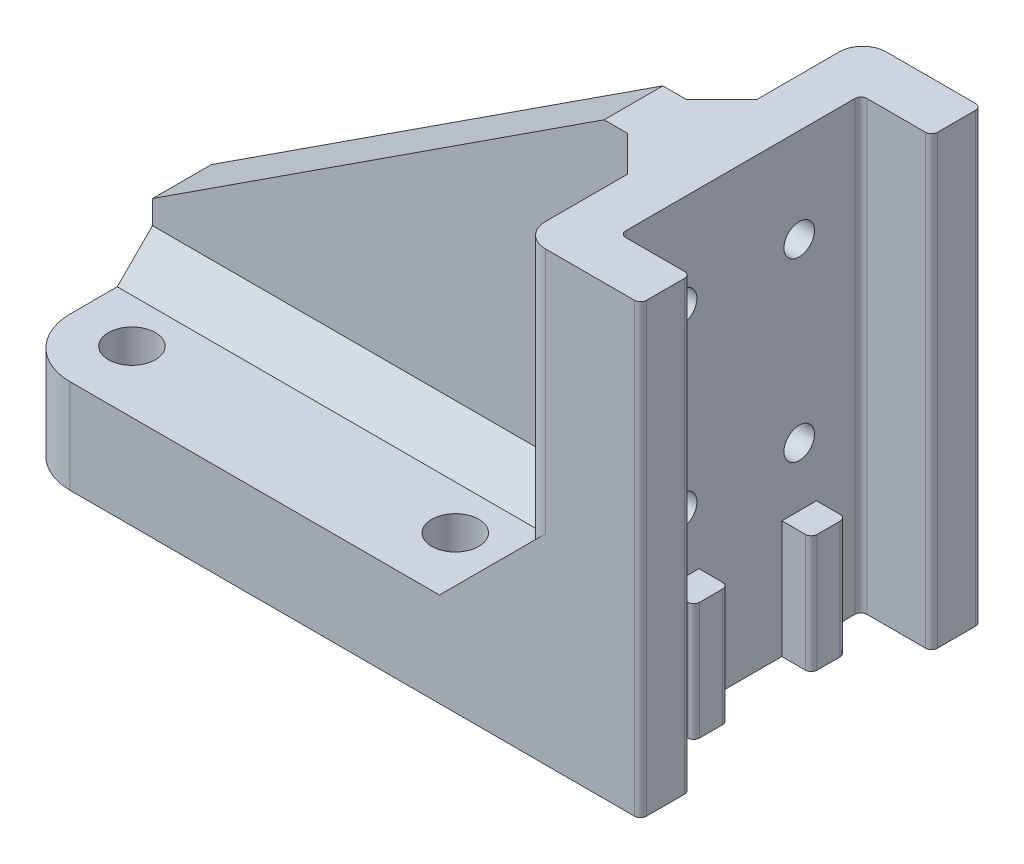
from build123d import *

# Parameters (mm, degrees)
ESQUISSE1_W             = 75
ESQUISSE1_H             = 58
ESQUISSE1_R             = 4
BOSS_EXTRU_1_DEPTH      = 16
ESQUISSE2_W             = 58
ESQUISSE2_H             = 16
BOSS_EXTRU_2_DEPTH      = 20
ESQUISSE3_W             = 8.190465892
ESQUISSE3_H             = 58
BOSS_EXTRU_3_DEPTH      = 60
ESQUISSE4_W             = 8.5
ESQUISSE4_H             = 76
BOSS_EXTRU_4_DEPTH      = 12
ESQUISSE5_W             = 5.9
ESQUISSE5_H             = 20
BOSS_EXTRU_5_DEPTH      = 5
ESQUISSE6_W             = 10
ESQUISSE6_H             = 60
BOSS_EXTRU_6_DEPTH      = 86.809534108
ESQUISSE7_R             = 2.6
ENL_V_MAT_EXTRU_1_DEPTH = 119.965941395
ESQUISSE8_R             = 4.5
ENL_V_MAT_EXTRU_2_DEPTH = 3
ENL_V_MAT_EXTRU_3_DEPTH = 109.45390726
CHANFREIN1_SIZE         = 14
CHANFREIN2_SIZE         = 6
CHANFREIN3_SIZE         = 6
CONG_1_R                = 10
CONG_2_R                = 4
CONG_3_R                = 1
CONG_4_R                = 1


with BuildPart() as part:
    # Esquisse1 → Boss.-Extru.1 (new body)
    with BuildSketch(Plane(origin=(0, 0, 0), x_dir=(1, 0, 0), z_dir=(0, 1, 0))):
        Rectangle(ESQUISSE1_W, ESQUISSE1_H)
        with Locations(Location((-27.5, 18.5, 0), (0, 0, 270))):
            Circle(ESQUISSE1_R, mode=Mode.SUBTRACT)
        with Locations(Location((27.5, 18.5, 0), (0, 0, 90))):
            Circle(ESQUISSE1_R, mode=Mode.SUBTRACT)
        with Locations(Location((27.5, -18.5, 0), (0, 0, 270))):
            Circle(ESQUISSE1_R, mode=Mode.SUBTRACT)
        with Locations(Location((-27.5, -18.5, 0), (0, 0, 90))):
            Circle(ESQUISSE1_R, mode=Mode.SUBTRACT)
    extrude(amount=BOSS_EXTRU_1_DEPTH)

    # Esquisse2 → Boss.-Extru.2 (add)
    with BuildSketch(Plane(origin=(37.5, 0, 0), x_dir=(0, 0, -1), z_dir=(1, 0, 0))):
        with Locations((0, 8)):
            Rectangle(ESQUISSE2_W, ESQUISSE2_H)
    extrude(amount=BOSS_EXTRU_2_DEPTH)

    # Esquisse3 → Boss.-Extru.3 (add)
    with BuildSketch(Plane(origin=(0, 16, 0), x_dir=(1, 0, 0), z_dir=(0, 1, 0))):
        with Locations((53.404767054, 0)):
            Rectangle(ESQUISSE3_W, ESQUISSE3_H)
    extrude(amount=BOSS_EXTRU_3_DEPTH)

    # Esquisse4 → Boss.-Extru.4 (add)
    with BuildSketch(Plane(origin=(57.5, 0, 0), x_dir=(0, 0, -1), z_dir=(1, 0, 0))):
        with Locations((24.75, 38)):
            Rectangle(ESQUISSE4_W, ESQUISSE4_H)
        with Locations((-24.75, 38)):
            Rectangle(ESQUISSE4_W, ESQUISSE4_H)
    extrude(amount=BOSS_EXTRU_4_DEPTH)

    # Esquisse5 → Boss.-Extru.5 (add)
    with BuildSketch(Plane(origin=(57.5, 0, 0), x_dir=(0, 0, -1), z_dir=(1, 0, 0))):
        with Locations((-10, 10)):
            Rectangle(ESQUISSE5_W, ESQUISSE5_H)
        with Locations((10, 10)):
            Rectangle(ESQUISSE5_W, ESQUISSE5_H)
    extrude(amount=BOSS_EXTRU_5_DEPTH)

    # Esquisse6 → Boss.-Extru.6 (add)
    with BuildSketch(Plane.ZY.offset(-49.309534108)):
        with Locations((0, 46)):
            Rectangle(ESQUISSE6_W, ESQUISSE6_H)
    extrude(amount=BOSS_EXTRU_6_DEPTH)

    # Esquisse7 → Enlèv. mat.-Extru.1 (cut, through all)
    with BuildSketch(Plane.ZY.offset(-49.309534108)):
        with Locations((-10, 60)):
            Circle(ESQUISSE7_R)
        with Locations((-10, 30)):
            Circle(ESQUISSE7_R)
        with Locations(Location((10, 30, 0), (0, 0, 180))):
            Circle(ESQUISSE7_R)
        with Locations(Location((10, 60, 0), (0, 0, 180))):
            Circle(ESQUISSE7_R)
    extrude(amount=-ENL_V_MAT_EXTRU_1_DEPTH, mode=Mode.SUBTRACT)

    # Esquisse8 → Enlèv. mat.-Extru.2 (cut)
    with BuildSketch(Plane.ZY.offset(-49.309534108)):
        with Locations((-10, 60)):
            Circle(ESQUISSE8_R)
        with Locations((-10, 30)):
            Circle(ESQUISSE8_R)
        with Locations((10, 60)):
            Circle(ESQUISSE8_R)
        with Locations((10, 30)):
            Circle(ESQUISSE8_R)
    extrude(amount=-ENL_V_MAT_EXTRU_2_DEPTH, mode=Mode.SUBTRACT)

    # Esquisse9 → Enlèv. mat.-Extru.3 (cut, through all)
    with BuildSketch(Plane(origin=(0, 0, -5), x_dir=(-1, 0, 0), z_dir=(0, 0, -1))):
        Polygon((-39.309534108, 76), (37.5, 26), (37.5, 76), align=None)
    extrude(amount=-ENL_V_MAT_EXTRU_3_DEPTH, mode=Mode.SUBTRACT)

    # Chanfrein1
    # the kernel refuses this chamfer: 14 mm, written as the material it adds along each edge
    with BuildSketch(Plane(origin=(49.309534108, 16, -31.003561832), x_dir=(-0.9996219169112968, -0.027495876610586358, 0), z_dir=(0, 0, 1))) as chanfrein1_piece_1_section:
        Polygon((CHANFREIN1_SIZE * 0.999621916911, -CHANFREIN1_SIZE * 0.0274958766106), (-CHANFREIN1_SIZE * 0.0274958766106, -CHANFREIN1_SIZE * 0.999621916911), (0, 0), align=None)
    chanfrein1_piece_1 = extrude(amount=60.003561832, mode=Mode.PRIVATE)
    chanfrein1_piece_1 = split(chanfrein1_piece_1, bisect_by=Plane(origin=(44.612270729, 20.464073152, -29), z_dir=(0, 0, 1)), keep=Keep.TOP, mode=Mode.PRIVATE)
    chanfrein1_piece_1 = chanfrein1_piece_1 - Plane(origin=(44.612270729, 30, -10), x_dir=(0, 0, 1), z_dir=(-1, 0, 0)) * Cylinder(4.5, 176, mode=Mode.PRIVATE)
    chanfrein1_piece_1 = chanfrein1_piece_1 - Plane(origin=(44.612270729, 30, 10), x_dir=(0, 0, 1), z_dir=(-1, 0, 0)) * Cylinder(4.5, 176, mode=Mode.PRIVATE)
    add(chanfrein1_piece_1)
    with BuildSketch(Plane(origin=(49.309534108, 16, -29), x_dir=(0.02749587661058661, 0.9996219169112968, 0), z_dir=(0, 0, 1))) as chanfrein1_piece_2_section:
        Polygon((CHANFREIN1_SIZE * 0.999621916911, CHANFREIN1_SIZE * 0.0274958766106), (-CHANFREIN1_SIZE * 0.0274958766106, CHANFREIN1_SIZE * 0.999621916911), (0, 0), align=None)
    chanfrein1_piece_2 = extrude(amount=60.003561832, mode=Mode.PRIVATE)
    chanfrein1_piece_2 = chanfrein1_piece_2 - Plane(origin=(44.577827309, 30, -10), x_dir=(0, 0, 1), z_dir=(-1, 0, 0)) * Cylinder(4.5, 176, mode=Mode.PRIVATE)
    chanfrein1_piece_2 = split(chanfrein1_piece_2, bisect_by=Plane(origin=(44.577827309, 20.39830905, 29), z_dir=(0, 0, -1)), keep=Keep.TOP, mode=Mode.PRIVATE)
    chanfrein1_piece_2 = chanfrein1_piece_2 - Plane(origin=(44.577827309, 30, 10), x_dir=(0, 0, 1), z_dir=(-1, 0, 0)) * Cylinder(4.5, 176, mode=Mode.PRIVATE)
    add(chanfrein1_piece_2)

    # Chanfrein2
    chanfrein2_edges = [part.edges().sort_by_distance(p)[0] for p in [
        (-1.095232946, 16, 5),
        (-1.095232946, 16, -5),
    ]]
    chamfer(chanfrein2_edges, length=CHANFREIN2_SIZE)

    # Chanfrein3
    # the kernel refuses this chamfer: 6 mm, written as the material it adds along each edge
    with BuildSketch(Plane(origin=(49.309534108, 76, 5), x_dir=(-0.9996219169112968, 0, -0.027495876610586334), z_dir=(0, -1, 0))) as chanfrein3_piece_1_section:
        Polygon((CHANFREIN3_SIZE * 0.999621916911, -CHANFREIN3_SIZE * 0.0274958766106), (-CHANFREIN3_SIZE * 0.0274958766106, -CHANFREIN3_SIZE * 0.999621916911), (0, 0), align=None)
    chanfrein3_piece_1 = extrude(amount=61.430097928, mode=Mode.PRIVATE)
    chanfrein3_piece_1 = chanfrein3_piece_1 - Plane(origin=(47.194482269, 30, 10), x_dir=(0, 0, 1), z_dir=(-1, 0, 0)) * Cylinder(4.5, 147, mode=Mode.PRIVATE)
    chanfrein3_piece_1 = chanfrein3_piece_1 - Plane(origin=(47.194482269, 60, 10), x_dir=(0, 0, 1), z_dir=(-1, 0, 0)) * Cylinder(4.5, 147, mode=Mode.PRIVATE)
    add(chanfrein3_piece_1)
    with BuildSketch(Plane(origin=(49.309534108, 14.569902072, -5), x_dir=(-0.9996219169112968, 0, 0.027495876610586334), z_dir=(0, 1, 0))) as chanfrein3_piece_2_section:
        Polygon((CHANFREIN3_SIZE * 0.999621916911, -CHANFREIN3_SIZE * 0.0274958766106), (-CHANFREIN3_SIZE * 0.0274958766106, -CHANFREIN3_SIZE * 0.999621916911), (0, 0), align=None)
    chanfrein3_piece_2 = extrude(amount=61.430097928, mode=Mode.PRIVATE)
    chanfrein3_piece_2 = chanfrein3_piece_2 - Plane(origin=(47.377575529, 30, -10), x_dir=(0, 0, 1), z_dir=(-1, 0, 0)) * Cylinder(4.5, 147, mode=Mode.PRIVATE)
    chanfrein3_piece_2 = chanfrein3_piece_2 - Plane(origin=(47.377575529, 60, -10), x_dir=(0, 0, 1), z_dir=(-1, 0, 0)) * Cylinder(4.5, 147, mode=Mode.PRIVATE)
    add(chanfrein3_piece_2)

    # Congé1
    cong_1_edges = [part.edges().sort_by_distance(p)[0] for p in [
        (-37.5, 8, -29),
        (-37.5, 8, 29),
    ]]
    fillet(cong_1_edges, radius=CONG_1_R)

    # Congé2
    cong_2_edges = [part.edges().sort_by_distance(p)[0] for p in [
        (49.309534108, 53, -29),
        (49.309534108, 53, 29),
    ]]
    fillet(cong_2_edges, radius=CONG_2_R)

    # Congé3
    cong_3_edges = [part.edges().sort_by_distance(p)[0] for p in [
        (69.5, 38, 29),
        (69.5, 38, 20.5),
        (69.5, 38, -20.5),
        (69.5, 38, -29),
    ]]
    fillet(cong_3_edges, radius=CONG_3_R)

    # Congé4
    cong_4_edges = [part.edges().sort_by_distance(p)[0] for p in [
        (57.5, 38, 20.5),
        (57.5, 38, -20.5),
        (62.5, 10, 12.95),
        (62.5, 10, 7.05),
        (62.5, 10, -7.05),
        (62.5, 10, -12.95),
    ]]
    fillet(cong_4_edges, radius=CONG_4_R)


solid = part.part
